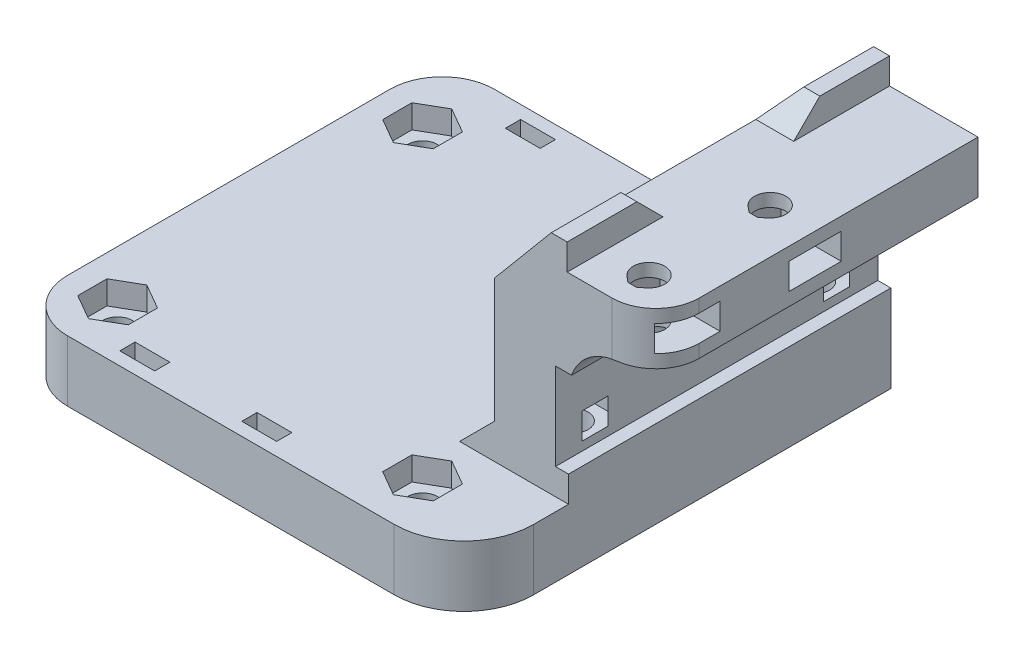
from build123d import *

# Parameters (mm, degrees)
CROQUIS16_W                  = 51.5
CROQUIS16_H                  = 49
SALIENTE_EXTRUIR3_DEPTH      = 7
SALIENTE_EXTRUIR4_DEPTH      = 37
TALADRO_DE_MARGEN_PARA_M31_D = 3.4
REDONDEO1_R                  = 6
REDONDEO2_R                  = 8
CORTAR_EXTRUIR14_DEPTH       = 2.7
REDONDEO3_R                  = 6
CORTAR_EXTRUIR12_DEPTH       = 55.612269684
REDONDEO11_R                 = 5
SALIENTE_EXTRUIR5_DEPTH      = 37
CHAFL_N3_SIZE                = 4
CHAFL_N3_SIZE2               = 4.76701437
CROQUIS29_R                  = 1.75
CORTAR_EXTRUIR17_DEPTH       = 18
CORTAR_EXTRUIR18_DEPTH       = 3
CORTAR_EXTRUIR20_DEPTH       = 3
CORTAR_EXTRUIR21_REACH       = 53.103
CROQUIS31_W                  = 4
CROQUIS31_H                  = 1.75
SALIENTE_EXTRUIR10_DEPTH     = 8
CHAFL_N7_SIZE                = 3
CORTAR_EXTRUIR22_START       = -40
CORTAR_EXTRUIR22_DEPTH       = 40


with BuildPart() as part:
    # Croquis16 → Saliente-Extruir3 (new body)
    with BuildSketch(Plane(origin=(0, 0, 0), x_dir=(1, 0, 0), z_dir=(0, 1, 0))):
        with Locations((2.75, 0)):
            Rectangle(CROQUIS16_W, CROQUIS16_H)
    extrude(amount=SALIENTE_EXTRUIR3_DEPTH)

    # Croquis17 → Saliente-Extruir4 (add)
    with BuildSketch(Plane.XY.offset(-24.5)):
        Polygon((38.5, 30), (38.5, 24), (28.5, 24), (28.5, 7), (20, 7), (20, 30), align=None)
    extrude(amount=SALIENTE_EXTRUIR4_DEPTH)

    # Taladro de margen para M31 (through all)
    with Locations(Plane(origin=(0, 7, 0), x_dir=(1, 0, 0), z_dir=(0, 1, 0))):
        with Locations((-17.5, 16.75), (17.5, -18.25), (-17.5, -18.25)):
            Hole(TALADRO_DE_MARGEN_PARA_M31_D / 2)

    # Redondeo1
    redondeo1_edges = [part.edges().sort_by_distance(p)[0] for p in [
        (-23, 3.5, -24.5),
        (-23, 3.5, 24.5),
    ]]
    fillet(redondeo1_edges, radius=REDONDEO1_R)

    # Redondeo2
    redondeo2_edges = [part.edges().sort_by_distance(p)[0] for p in [
        (28.5, 3.5, 24.5),
    ]]
    fillet(redondeo2_edges, radius=REDONDEO2_R)

    # Croquis24 → Cortar-Extruir14 (cut)
    with BuildSketch(Plane(origin=(0, 7, 0), x_dir=(1, 0, 0), z_dir=(0, 1, 0))):
        Polygon((-17.5, -21.598631561), (-14.6, -19.924315781), (-14.6, -16.575684219), (-17.5, -14.901368439), (-20.4, -16.575684219), (-20.4, -19.924315781), align=None)
        Polygon((17.5, -21.598631561), (20.4, -19.924315781), (20.4, -16.575684219), (17.5, -14.901368439), (14.6, -16.575684219), (14.6, -19.924315781), align=None)
        Polygon((-17.5, 20.098631561), (-20.4, 18.424315781), (-20.4, 15.075684219), (-17.5, 13.401368439), (-14.6, 15.075684219), (-14.6, 18.424315781), align=None)
    extrude(amount=-CORTAR_EXTRUIR14_DEPTH, mode=Mode.SUBTRACT)

    # Redondeo3
    redondeo3_edges = [part.edges().sort_by_distance(p)[0] for p in [
        (28.5, 24, -6),
    ]]
    fillet(redondeo3_edges, radius=REDONDEO3_R)

    # Croquis21 → Cortar-Extruir12 (cut, through all)
    with BuildSketch(Plane(origin=(0, 30, 0), x_dir=(1, 0, 0), z_dir=(0, 1, 0))):
        with BuildLine():
            Line((34.507017697, 4.421120002), (33.85, 3.869816695))
            Line((33.85, 3.869816695), (32.85, 3.869816695))
            Line((32.85, 3.869816695), (32.192982303, 4.421120002))
            ThreePointArc((32.192982303, 4.421120002), (33.35, 7.6), (34.507017697, 4.421120002))
        make_face()
        with BuildLine():
            Line((33.85, -10.035183305), (32.85, -10.035183305))
            Line((32.85, -10.035183305), (32.192982303, -9.483879998))
            ThreePointArc((32.192982303, -9.483879998), (33.35, -6.305), (34.507017697, -9.483879998))
            Line((34.507017697, -9.483879998), (33.85, -10.035183305))
        make_face()
    extrude(amount=-CORTAR_EXTRUIR12_DEPTH, mode=Mode.SUBTRACT)

    # Redondeo11
    redondeo11_edges = [part.edges().sort_by_distance(p)[0] for p in [
        (38.5, 27, 12.5),
    ]]
    fillet(redondeo11_edges, radius=REDONDEO11_R)

    # Croquis26 → Saliente-Extruir5 (add)
    with BuildSketch(Plane(origin=(0, 0, -24.5), x_dir=(-1, 0, 0), z_dir=(0, 0, -1))):
        Polygon((-20, 11), (-16, 7), (-20, 7), align=None)
    extrude(amount=-SALIENTE_EXTRUIR5_DEPTH)

    # Chaflán3
    chafl_n3_edges = [part.edges().sort_by_distance(p)[0] for p in [
        (20, 30, -6),
    ]]
    chafl_n3_side = [part.faces().sort_by_distance(p)[0] for p in [
        (29.053844861, 30, -6.369586264),
    ]]
    chamfer(chafl_n3_edges, length=CHAFL_N3_SIZE, length2=CHAFL_N3_SIZE2, reference=chafl_n3_side[0])

    # Croquis29 → Cortar-Extruir17 (cut)
    with BuildSketch(Plane.XZ):
        with Locations(Location((24.45, -19.75, 0), (0, 0, 270))):
            Circle(CROQUIS29_R)
        with Locations(Location((24.45, 7.95, 0), (0, 0, 270))):
            Circle(CROQUIS29_R)
    extrude(amount=-CORTAR_EXTRUIR17_DEPTH, mode=Mode.SUBTRACT)

    # Croquis30 → Cortar-Extruir18 (cut)
    with BuildSketch(Plane(origin=(0, 11, 0), x_dir=(-1, 0, 0), z_dir=(0, -1, 0))):
        Polygon((-22.746816706, 16.8), (-20, 16.8), (-20, 22.7), (-22.746816706, 22.7), (-26.153183294, 22.7), (-27.856366588, 19.75), (-26.153183294, 16.8), align=None)
        Polygon((-20, -10.9), (-22.746816706, -10.9), (-26.153183294, -10.9), (-27.856366588, -7.95), (-26.153183294, -5), (-22.746816706, -5), (-20, -5), align=None)
    extrude(amount=-CORTAR_EXTRUIR18_DEPTH, mode=Mode.SUBTRACT)

    # Croquis25 → Cortar-Extruir20 (cut)
    with BuildSketch(Plane.XZ.offset(-28.5)):
        Polygon((35.082050808, -2.8), (38.5, -2.8), (38.5, -8.8), (35.082050808, -8.8), (31.617949192, -8.8), (29.885898385, -5.8), (31.617949192, -2.8), align=None)
        Polygon((31.617949192, 11.105), (29.885898385, 8.105), (31.617949192, 5.105), (35.082050808, 5.105), (40.5, 5.105), (40.5, 11.105), (35.082050808, 11.105), align=None)
    extrude(amount=CORTAR_EXTRUIR20_DEPTH, mode=Mode.SUBTRACT)

    # Croquis31 → Cortar-Extruir21 (cut, up to next)
    with BuildSketch(Plane(origin=(0, 7, 0), x_dir=(1, 0, 0), z_dir=(0, 1, 0)), mode=Mode.PRIVATE) as cortar_extruir21_sk1:
        with Locations((3.5, 22.125)):
            Rectangle(CROQUIS31_W, CROQUIS31_H)
    cortar_extruir21_tool1 = extrude(cortar_extruir21_sk1.sketch, amount=-CORTAR_EXTRUIR21_REACH, mode=Mode.PRIVATE) & part.part
    # Croquis31 → Cortar-Extruir21 (cut, up to next)
    with BuildSketch(Plane(origin=(0, 7, 0), x_dir=(1, 0, 0), z_dir=(0, 1, 0)), mode=Mode.PRIVATE) as cortar_extruir21_sk2:
        with Locations((3.5, -22.125)):
            Rectangle(CROQUIS31_W, CROQUIS31_H)
    cortar_extruir21_tool2 = extrude(cortar_extruir21_sk2.sketch, amount=-CORTAR_EXTRUIR21_REACH, mode=Mode.PRIVATE) & part.part
    cortar_extruir21_1 = cortar_extruir21_tool1.solids().sort_by_distance((3.5, 7, -22.125))[0]
    add(cortar_extruir21_1, mode=Mode.SUBTRACT)
    cortar_extruir21_2 = cortar_extruir21_tool2.solids().sort_by_distance((3.5, 7, 22.125))[0]
    add(cortar_extruir21_2, mode=Mode.SUBTRACT)
    cortar_extruir21 = cortar_extruir21_1 + cortar_extruir21_2  # Cortar-Extruir21 as one shape, for the pattern or mirror that repeats it

    # Croquis38 → Saliente-Extruir10 (add)
    with BuildSketch(Plane(origin=(0, 0, -24.5), x_dir=(-1, 0, 0), z_dir=(0, 0, -1))):
        Polygon((-24, 30), (-28.35, 30), (-28.35, 33), (-26.517298894, 33), align=None)
    saliente_extruir10 = extrude(amount=-SALIENTE_EXTRUIR10_DEPTH)

    # Simetría3: Saliente-Extruir10 across plane
    add(saliente_extruir10.mirror(Plane(origin=(0, 0, -6), x_dir=(1, 0, 0), z_dir=(0, 0, -1))))

    # Chaflán7
    chafl_n7_edges = [part.edges().sort_by_distance(p)[0] for p in [
        (26.175, 30, 4.5),
        (26.175, 30, -16.5),
    ]]
    chamfer(chafl_n7_edges, length=CHAFL_N7_SIZE - 0.0001)  # a hair under: the kernel refuses the full size

    # Simetría4: Cortar-Extruir21 across plane
    add(cortar_extruir21.mirror(Plane(origin=(-3.5, 0, 0), x_dir=(0, 0, 1), z_dir=(1, 0, 0))), mode=Mode.SUBTRACT)

    # Croquis39 → Cortar-Extruir22 (cut)
    with BuildSketch(Plane(origin=(0, 0, -24.5), x_dir=(-1, 0, 0), z_dir=(0, 0, -1)).offset(CORTAR_EXTRUIR22_START)):
        with BuildLine():
            Line((-28.5, 10), (-28.5, 18))
            ThreePointArc((-28.5, 18), (-28.586408642, 19.014611872), (-28.843145751, 20))
            Line((-28.843145751, 20), (-30, 20))
            Line((-30, 20), (-30, 10))
            Line((-30, 10), (-28.5, 10))
        make_face()
        Polygon((-27, 20), (-28.5, 20), (-28.5, 18), (-28.5, 10), (-27, 10), align=None)
        with BuildLine():
            Line((-28.5, 18), (-28.5, 20))
            Line((-28.5, 20), (-28.843145751, 20))
            ThreePointArc((-28.843145751, 20), (-28.586408642, 19.014611872), (-28.5, 18))
        make_face()
    extrude(amount=CORTAR_EXTRUIR22_DEPTH, mode=Mode.SUBTRACT)


solid = part.part
